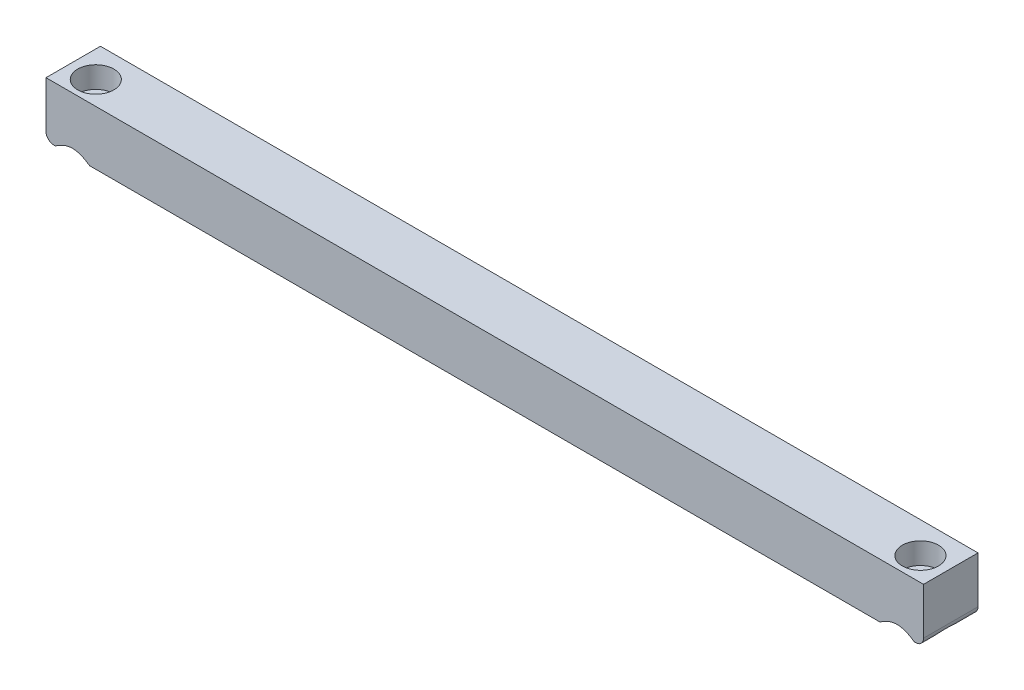
from build123d import *

# Parameters (mm, degrees)
SKETCH1_W                                      = 112.8
SKETCH1_H                                      = 7
BOSS_EXTRUDE1_DEPTH                            = 7
CSK_FOR_4_FLAT_HEAD_MACHINE_SCREW1_D           = 2.9464
CSK_FOR_4_FLAT_HEAD_MACHINE_SCREW1_CSINK_D     = 7.4535792
CSK_FOR_4_FLAT_HEAD_MACHINE_SCREW1_CSINK_ANGLE = 82
FILLET1_R                                      = 1
SKETCH5_R                                      = 2.325
F_4_40_REGISTRATION_HOLE_DEPTH                 = 2.75


with BuildPart() as part:
    # Sketch1 → Boss-Extrude1 (new body)
    with BuildSketch(Plane(origin=(0, 0, 0), x_dir=(1, 0, 0), z_dir=(0, 1, 0))):
        with Locations((56.4, 3.5)):
            Rectangle(SKETCH1_W, SKETCH1_H)
    extrude(amount=BOSS_EXTRUDE1_DEPTH)

    # CSK for #4 Flat Head Machine Screw1 (through all)
    with Locations(Plane(origin=(0, 0, 0), x_dir=(-1, 0, 0), z_dir=(0, -1, 0))):
        with Locations((-109.4, 3), (-3.4, 3)):
            CounterSinkHole(CSK_FOR_4_FLAT_HEAD_MACHINE_SCREW1_D / 2, CSK_FOR_4_FLAT_HEAD_MACHINE_SCREW1_CSINK_D / 2, counter_sink_angle=CSK_FOR_4_FLAT_HEAD_MACHINE_SCREW1_CSINK_ANGLE)

    # Fillet1
    # the kernel refuses this fillet: 1 mm, written as the material it takes off along each edge
    with BuildSketch(Plane(origin=(0, 0, -9.5), x_dir=(0, 1, 0), z_dir=(0, 0, 1)), Plane(origin=(112.8, 0, -2.026093288), x_dir=(0, 1, 0), z_dir=(0, 0, -1))) as fillet1_piece_1:
        with BuildLine():
            CenterArc((FILLET1_R, -FILLET1_R), FILLET1_R, 90, 90)
            Line((0, -FILLET1_R), (0, 0))
            Line((0, 0), (FILLET1_R, 0))
        make_face()
    extrude(amount=7.473906712, mode=Mode.SUBTRACT)
    with BuildSketch(Plane(origin=(0, 0, -3.973906712), x_dir=(0, 1, 0), z_dir=(0, 0, 1)), Plane(origin=(112.8, 0, 2.5), x_dir=(0, 1, 0), z_dir=(0, 0, -1))) as fillet1_piece_2:
        with BuildLine():
            CenterArc((FILLET1_R, -FILLET1_R), FILLET1_R, 90, 90)
            Line((0, -FILLET1_R), (0, 0))
            Line((0, 0), (FILLET1_R, 0))
        make_face()
    extrude(amount=6.473906712, mode=Mode.SUBTRACT)

    # Sketch5 → 4-40 registration hole (cut)
    with BuildSketch(Plane(origin=(0, 7, 0), x_dir=(1, 0, 0), z_dir=(0, 1, 0))):
        with Locations(Location((3.4, 3, 0), (0, 0, 270))):
            Circle(SKETCH5_R)
    f_4_40_registration_hole = extrude(amount=-F_4_40_REGISTRATION_HOLE_DEPTH, mode=Mode.SUBTRACT)

    # Mirror1: 4-40 registration hole across plane
    add(f_4_40_registration_hole.mirror(Plane(origin=(56.4, 0, 0), x_dir=(0, 0, 1), z_dir=(1, 0, 0))), mode=Mode.SUBTRACT)


solid = part.part
